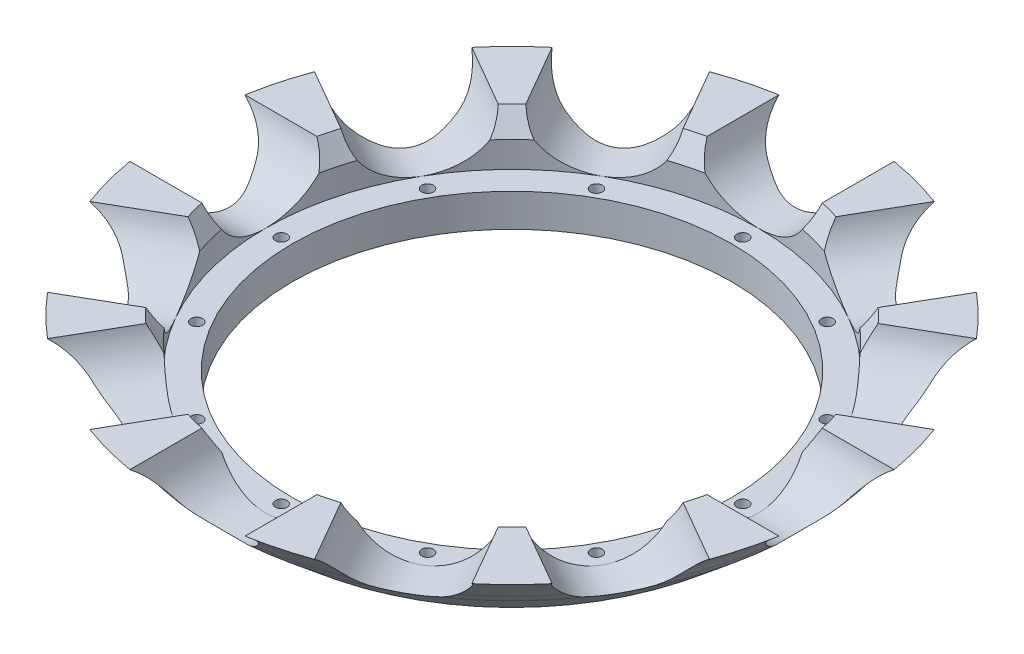
from build123d import *

# Parameters (mm, degrees)
SKETCH1_W          = 6.5
SKETCH1_H          = 9
SKETCH2_R          = 1.6
CUT_EXTRUDE1_DEPTH = 95.474864382
CIRPATTERN1_COUNT  = 12
SKETCH4_R          = 16
CUT_EXTRUDE2_DEPTH = 132.240237732
CIRPATTERN2_COUNT  = 12


with BuildPart() as part:
    # Sketch1 → Revolve1 (revolve)
    with BuildSketch(Plane.XY):
        with Locations((-63.25, 14.465)):
            Rectangle(SKETCH1_W, SKETCH1_H)
    revolve(axis=Axis((0, -200069.047495165, 0), (0, 1, 0)))

    # Sketch2 → Cut-Extrude1 (cut, through all)
    with BuildSketch(Plane(origin=(0, 18.965, 0), x_dir=(1, 0, 0), z_dir=(0, 1, 0))):
        with Locations((0, 63)):
            Circle(SKETCH2_R)
    cut_extrude1 = extrude(amount=-CUT_EXTRUDE1_DEPTH, mode=Mode.SUBTRACT)

    # CirPattern1: Cut-Extrude1 ×12 about axis
    cirpattern1_axis = Axis((0, -200069.047495165, 0), (0, -1, 0))
    for i in range(1, CIRPATTERN1_COUNT):
        add(cut_extrude1.rotate(cirpattern1_axis, i * 360 / CIRPATTERN1_COUNT), mode=Mode.SUBTRACT)

    # Sketch3 → Revolve2 (revolve)
    with BuildSketch(Plane.XY):
        with BuildLine():
            Line((-66.5, 18.965), (-66.5, 9.965))
            Line((-66.5, 9.965), (-78.5, 20.034195574))
            ThreePointArc((-78.5, 20.034195574), (-79.987399004, 21.45961793), (-81.274272951, 23.068387688))
            ThreePointArc((-81.274272951, 23.068387688), (-85.267770471, 27.895045483), (-90, 32))
            Line((-90, 32), (-84.07974624, 32))
            Line((-84.07974624, 32), (-70.744358791, 32))
            Line((-70.744358791, 32), (-67.3, 26.034195574))
            Line((-67.3, 26.034195574), (-67.3, 20.034195574))
            Line((-67.3, 20.034195574), (-67.3, 18.965))
            Line((-67.3, 18.965), (-66.5, 18.965))
        make_face()
    revolve(axis=Axis((0, 0, 0), (0, 1, 0)))

    # Sketch4 → Cut-Extrude2 (cut, through all)
    with BuildSketch(Plane.XY):
        with Locations((0, 34.965)):
            Circle(SKETCH4_R)
    cut_extrude2 = extrude(amount=CUT_EXTRUDE2_DEPTH, mode=Mode.SUBTRACT)

    # CirPattern2: Cut-Extrude2 ×12 about axis
    cirpattern2_axis = Axis((0, 9.965, 0), (0, -1, 0))
    for i in range(1, CIRPATTERN2_COUNT):
        add(cut_extrude2.rotate(cirpattern2_axis, i * 360 / CIRPATTERN2_COUNT), mode=Mode.SUBTRACT)


solid = part.part
